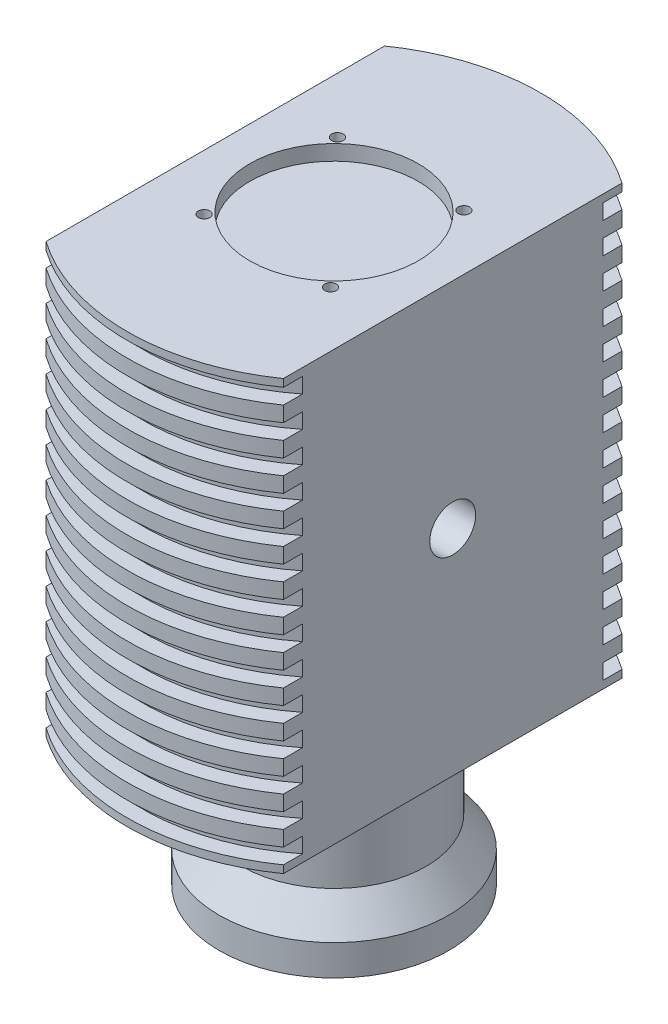
from build123d import *
from build123d.topology import SkipClean

# Parameters (mm, degrees)
SKETCH4_R          = 5
CUT_EXTRUDE1_DEPTH = 20
THREAD1_PITCH      = 1.25
CUT_EXTRUDE2_DEPTH = 171.105850025
SKETCH8_R          = 6
CUT_EXTRUDE3_DEPTH = 173.812036618
SKETCH9_R          = 22
CUT_EXTRUDE4_DEPTH = 4
SKETCH10_R         = 1.5
CUT_EXTRUDE5_DEPTH = 5
SKETCH11_R         = 28
CUT_EXTRUDE6_DEPTH = 4
SKETCH12_R         = 1.5
CUT_EXTRUDE7_DEPTH = 4


with BuildPart() as part:
    # Sketch1 → Revolve1 (revolve)
    with BuildSketch(Plane.XY, mode=Mode.PRIVATE) as revolve1_sk:
        Polygon((0, 0), (30, 0), (30, 8), (24, 16), (24, 40), (54, 40), (54, 42), (50, 42), (50, 46), (54, 46), (54, 50), (50, 50), (50, 54), (54, 54), (54, 58), (50, 58), (50, 62), (54, 62), (54, 66), (50, 66), (50, 70), (54, 70), (54, 74), (50, 74), (50, 78), (54, 78), (54, 82), (50, 82), (50, 86), (54, 86), (54, 90), (50, 90), (50, 94), (54, 94), (54, 98), (50, 98), (50, 102), (54, 102), (54, 106), (50, 106), (50, 110), (54, 110), (54, 114), (50, 114), (50, 118), (54, 118), (54, 122), (50, 122), (50, 126), (54, 126), (54, 130), (50, 130), (50, 134), (54, 134), (54, 138), (50, 138), (50, 142), (54, 142), (54, 146), (50, 146), (50, 150), (54, 150), (54, 152), (0, 152), (0, 50), align=None)
    revolve(revolve1_sk.sketch.rotate(Axis((0, 76.212305102, 0), (0, -1, 0)), 90), axis=Axis((0, 76.212305102, 0), (0, -1, 0)))

    # Sketch4 → Cut-Extrude1 (cut)
    with BuildSketch(Plane.XZ):
        with Locations(Location((0, 0, 0), (0, 0, 270))):
            Circle(SKETCH4_R)
    extrude(amount=-CUT_EXTRUDE1_DEPTH, mode=Mode.SUBTRACT)

    # Thread1: the profile of Thread Profile3 profile screwed along a right-hand helix of 16 turns, 8 arcs to a turn; built about Z, then put on its axis
    with SkipClean():  # the faces are left unmerged after this step: merging them gives an invalid solid
        thread1_z = Axis((0, 0, 0), (0, 0, 1))
        thread1_corners = [(4.9997, 0, -0.000173205), (5.676582344, 0, 0.390624998), (5.676582344, 0, 0.546874998), (4.9997, 0, 0.937673202)]
        with BuildLine(mode=Mode.PRIVATE) as thread1_profile:
            Line(thread1_corners[0], thread1_corners[1])
            Line(thread1_corners[1], thread1_corners[2])
            Line(thread1_corners[2], thread1_corners[3])
            Line(thread1_corners[3], thread1_corners[0])
        thread1_cap = Face(thread1_profile.wire())
        thread1_turn_angles = [0, 22.5, 45, 67.5, 90, 112.5, 135, 157.5, 180, 202.5, 225, 247.5, 270, 292.5, 315, 337.5, 360]
        thread1_turn_weights = [1, 0.9238795325112867, 1, 0.9238795325112867, 1, 0.9238795325112867, 1, 0.9238795325112867, 1, 0.9238795325112867, 1, 0.9238795325112867, 1, 0.9238795325112867, 1, 0.9238795325112867, 1]
        thread1_turn_rails = [Edge.make_bspline([Vector(p[0], p[1], 0).rotate(thread1_z, thread1_turn_angles[k]) / thread1_turn_weights[k] + Vector(0, 0, p[2] + THREAD1_PITCH * thread1_turn_angles[k] / 360) for k in range(17)], [0, 0, 0, 1, 1, 2, 2, 3, 3, 4, 4, 5, 5, 6, 6, 7, 7, 8, 8, 8], 2, thread1_turn_weights) for p in thread1_corners]
        thread1_turn_sides = [Face.make_surface_from_curves(thread1_turn_rails[p[0]], thread1_turn_rails[p[1]]) for p in [(0, 1), (1, 2), (2, 3), (3, 0)]]
        thread1 = Plane(origin=(0, 0, 0), x_dir=(1, 0, 0), z_dir=(0, 1, 0)) * Solid(Shell([*[p.moved(Location((0, 0, THREAD1_PITCH * i))) for i in range(16) for p in thread1_turn_sides], thread1_cap, thread1_cap.rotate(thread1_z, 5760).moved(Location((0, 0, THREAD1_PITCH * 5760 / 360)))]))
        add(thread1, mode=Mode.SUBTRACT)

    # Sketch7 → Cut-Extrude2 (cut, through all)
    with SkipClean():  # the faces are left unmerged after this step: merging them gives an invalid solid
        with BuildSketch(Plane(origin=(0, 152, 0), x_dir=(1, 0, 0), z_dir=(0, 1, 0))):
            with BuildLine():
                Line((-31, -4e-09), (-31, 44.215381939))
                ThreePointArc((-31, 44.215381939), (-54, 0), (-31, -44.215381939))
                Line((-31, -44.215381939), (-31, -4e-09))
            make_face()
            with BuildLine():
                ThreePointArc((54, 0), (47.906158268, 24.919871589), (31, 44.215381939))
                Line((31, 44.215381939), (31, 0))
                Line((31, 0), (31, -44.215381939))
                ThreePointArc((31, -44.215381939), (47.906158268, -24.919871589), (54, 0))
            make_face()
        extrude(amount=-CUT_EXTRUDE2_DEPTH, mode=Mode.SUBTRACT)

    # Sketch8 → Cut-Extrude3 (cut, through all)
    with SkipClean():  # the faces are left unmerged after this step: merging them gives an invalid solid
        with BuildSketch(Plane.ZY.offset(31)):
            with Locations((0, 96)):
                Circle(SKETCH8_R)
        extrude(amount=-CUT_EXTRUDE3_DEPTH, mode=Mode.SUBTRACT)

    # Sketch9 → Cut-Extrude4 (cut)
    with SkipClean():  # the faces are left unmerged after this step: merging them gives an invalid solid
        with BuildSketch(Plane(origin=(0, 152, 0), x_dir=(1, 0, 0), z_dir=(0, 1, 0))):
            with Locations(Location((0, 0, 0), (0, 0, 270))):
                Circle(SKETCH9_R)
        extrude(amount=-CUT_EXTRUDE4_DEPTH, mode=Mode.SUBTRACT)

    # Sketch10 → Cut-Extrude5 (cut)
    with SkipClean():  # the faces are left unmerged after this step: merging them gives an invalid solid
        with BuildSketch(Plane(origin=(0, 152, 0), x_dir=(1, 0, 0), z_dir=(0, 1, 0))):
            with Locations(Location((-16.515841959, 17.413413347, 0), (0, 0, 270))):
                Circle(SKETCH10_R)
            with Locations(Location((16.515841959, 17.413413347, 0), (0, 0, 270))):
                Circle(SKETCH10_R)
            with Locations(Location((16.515841959, -17.413413347, 0), (0, 0, 270))):
                Circle(SKETCH10_R)
            with Locations(Location((-16.515841959, -17.413413347, 0), (0, 0, 270))):
                Circle(SKETCH10_R)
        extrude(amount=-CUT_EXTRUDE5_DEPTH, mode=Mode.SUBTRACT)

    # Sketch11 → Cut-Extrude6 (cut)
    with SkipClean():  # the faces are left unmerged after this step: merging them gives an invalid solid
        with BuildSketch(Plane.ZY.offset(31)):
            with Locations((0, 96)):
                Circle(SKETCH11_R)
        extrude(amount=-CUT_EXTRUDE6_DEPTH, mode=Mode.SUBTRACT)

    # Sketch12 → Cut-Extrude7 (cut)
    with SkipClean():  # the faces are left unmerged after this step: merging them gives an invalid solid
        with BuildSketch(Plane.ZY.offset(31)):
            with Locations((0, 133.5)):
                Circle(SKETCH12_R)
            with Locations((32.475952642, 114.75)):
                Circle(SKETCH12_R)
            with Locations((32.475952642, 77.25)):
                Circle(SKETCH12_R)
            with Locations((0, 58.5)):
                Circle(SKETCH12_R)
            with Locations((-32.475952642, 77.25)):
                Circle(SKETCH12_R)
            with Locations((-32.475952642, 114.75)):
                Circle(SKETCH12_R)
        extrude(amount=-CUT_EXTRUDE7_DEPTH, mode=Mode.SUBTRACT)


solid = part.part
